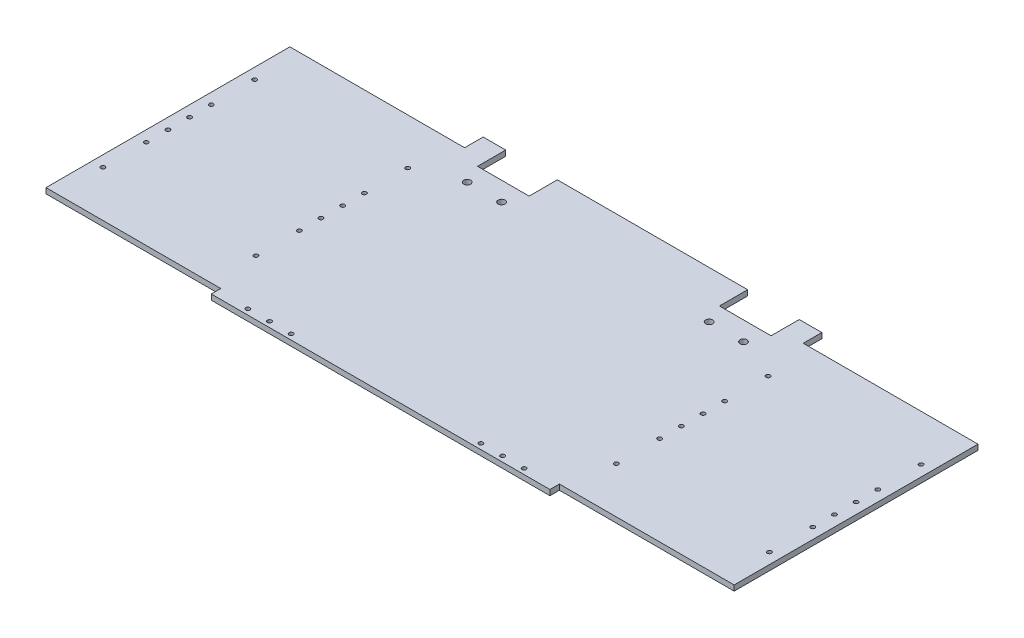
from build123d import *

# Parameters (mm, degrees)
SKETCH1_R           = 2.564
SKETCH1_R_2         = 1.55
BOSS_EXTRUDE1_DEPTH = 4


with BuildPart() as part:
    # Sketch1 → Boss-Extrude1 (new body)
    with BuildSketch(Plane(origin=(0, 0, 0), x_dir=(1, 0, 0), z_dir=(0, 1, 0))):
        Polygon((129, 0), (129, -7), (379, -7), (379, 0), (508, 0), (508, 180), (379, 180), (379, 193.718), (362.35, 193.718), (362.35, 172.89), (324.25, 172.89), (324.25, 193.718), (183.75, 193.718), (183.75, 172.89), (145.65, 172.89), (145.65, 193.718), (129, 193.718), (129, 180), (0, 180), (0, 0), align=None)
        with Locations((152, 158.92)):
            Circle(SKETCH1_R, mode=Mode.SUBTRACT)
        with Locations((177.4, 158.92)):
            Circle(SKETCH1_R, mode=Mode.SUBTRACT)
        with Locations((152, -3)):
            Circle(SKETCH1_R_2, mode=Mode.SUBTRACT)
        with Locations((184, -3)):
            Circle(SKETCH1_R_2, mode=Mode.SUBTRACT)
        with Locations((330.6, 158.92)):
            Circle(SKETCH1_R, mode=Mode.SUBTRACT)
        with Locations((356, 158.92)):
            Circle(SKETCH1_R, mode=Mode.SUBTRACT)
        with Locations((168, -3)):
            Circle(SKETCH1_R_2, mode=Mode.SUBTRACT)
        with Locations((324, -3)):
            Circle(SKETCH1_R_2, mode=Mode.SUBTRACT)
        with Locations((340, -3)):
            Circle(SKETCH1_R_2, mode=Mode.SUBTRACT)
        with Locations((356, -3)):
            Circle(SKETCH1_R_2, mode=Mode.SUBTRACT)
        with Locations((121, 146)):
            Circle(SKETCH1_R_2, mode=Mode.SUBTRACT)
        with Locations((121, 114)):
            Circle(SKETCH1_R_2, mode=Mode.SUBTRACT)
        with Locations((121, 98)):
            Circle(SKETCH1_R_2, mode=Mode.SUBTRACT)
        with Locations((121, 82)):
            Circle(SKETCH1_R_2, mode=Mode.SUBTRACT)
        with Locations((121, 66)):
            Circle(SKETCH1_R_2, mode=Mode.SUBTRACT)
        with Locations((121, 34)):
            Circle(SKETCH1_R_2, mode=Mode.SUBTRACT)
        with Locations((387, 146)):
            Circle(SKETCH1_R_2, mode=Mode.SUBTRACT)
        with Locations((387, 114)):
            Circle(SKETCH1_R_2, mode=Mode.SUBTRACT)
        with Locations((387, 98)):
            Circle(SKETCH1_R_2, mode=Mode.SUBTRACT)
        with Locations((387, 82)):
            Circle(SKETCH1_R_2, mode=Mode.SUBTRACT)
        with Locations((387, 66)):
            Circle(SKETCH1_R_2, mode=Mode.SUBTRACT)
        with Locations((387, 34)):
            Circle(SKETCH1_R_2, mode=Mode.SUBTRACT)
        with Locations((8, 146)):
            Circle(SKETCH1_R_2, mode=Mode.SUBTRACT)
        with Locations((8, 114)):
            Circle(SKETCH1_R_2, mode=Mode.SUBTRACT)
        with Locations((8, 98)):
            Circle(SKETCH1_R_2, mode=Mode.SUBTRACT)
        with Locations((8, 82)):
            Circle(SKETCH1_R_2, mode=Mode.SUBTRACT)
        with Locations((8, 66)):
            Circle(SKETCH1_R_2, mode=Mode.SUBTRACT)
        with Locations((8, 34)):
            Circle(SKETCH1_R_2, mode=Mode.SUBTRACT)
        with Locations((500, 34)):
            Circle(SKETCH1_R_2, mode=Mode.SUBTRACT)
        with Locations((500, 66)):
            Circle(SKETCH1_R_2, mode=Mode.SUBTRACT)
        with Locations((500, 82)):
            Circle(SKETCH1_R_2, mode=Mode.SUBTRACT)
        with Locations((500, 98)):
            Circle(SKETCH1_R_2, mode=Mode.SUBTRACT)
        with Locations((500, 114)):
            Circle(SKETCH1_R_2, mode=Mode.SUBTRACT)
        with Locations((500, 146)):
            Circle(SKETCH1_R_2, mode=Mode.SUBTRACT)
    extrude(amount=BOSS_EXTRUDE1_DEPTH)


solid = part.part
